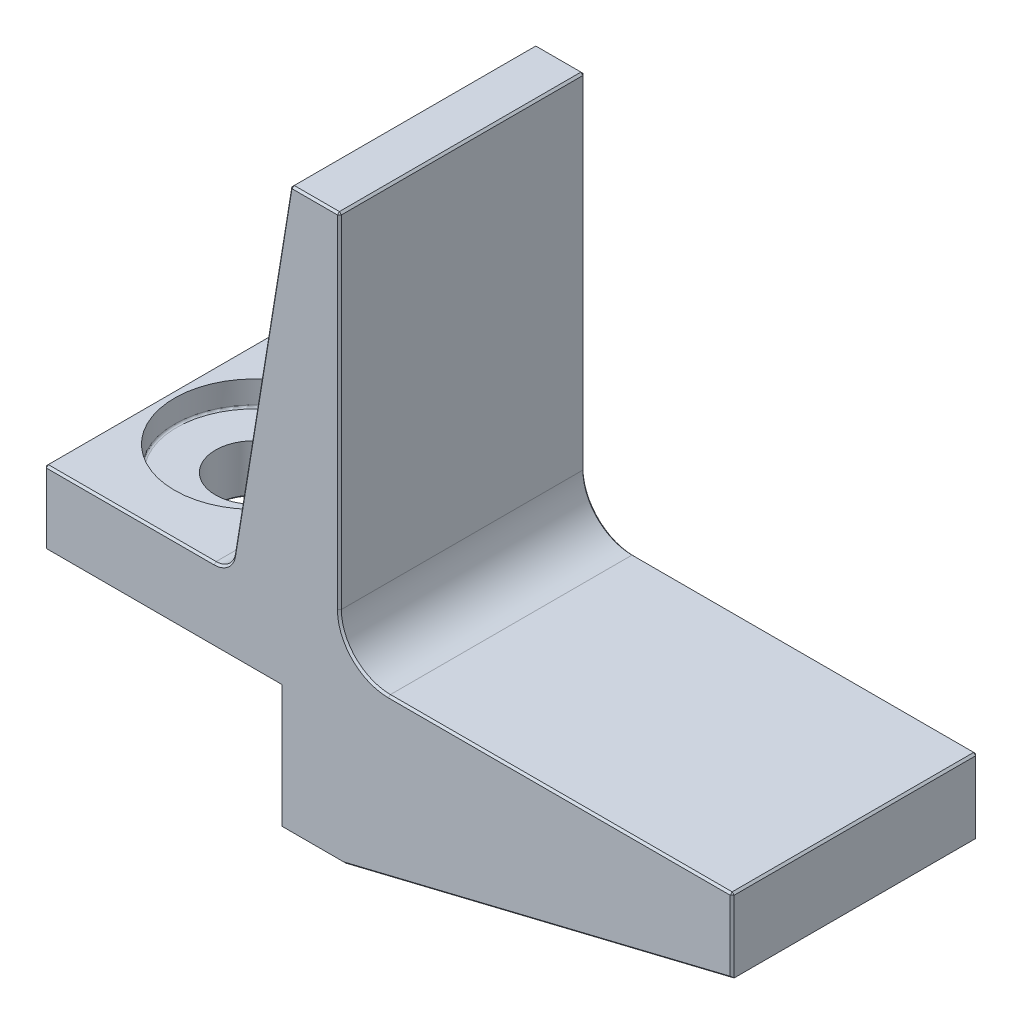
from build123d import *
from OCP.BRepFilletAPI import BRepFilletAPI_MakeChamfer

# Parameters (mm, degrees)
BOSS_EXTRUDE1_DEPTH                                  = 31.75
CBORE_FOR_3_8_BINDING_HEAD_MACHINE_SCREW_D           = 10.0838
CBORE_FOR_3_8_BINDING_HEAD_MACHINE_SCREW_CBORE_D     = 20.6756
CBORE_FOR_3_8_BINDING_HEAD_MACHINE_SCREW_CBORE_DEPTH = 3.175
FILLET1_R                                            = 2.54
FILLET2_R                                            = 6.35
CHAMFER1_SIZE                                        = 0.254
CHAMFER1_SIZE2                                       = 0.30739842
FILLET3_R                                            = 0.254
CHAMFER2_SIZE                                        = 0.254


with BuildPart() as part:
    # Sketch1 → Boss-Extrude1 (new body)
    with BuildSketch(Plane.XY):
        Polygon((0, 0), (50.8, 0), (50.8, -9.525), (0.5741924, -21.771101892), (-7.6808076, -21.771101892), (-7.6808076, -5.896101892), (-38.1608076, -5.896101892), (-38.1608076, 3.628898108), (-14.0308076, 3.628898108), (-6.35, 50.8), (0, 50.8), align=None)
    extrude(amount=BOSS_EXTRUDE1_DEPTH)

    # CBORE for 3/8 Binding Head Machine Screw1 (through all)
    with Locations(Plane(origin=(0, 3.628898108, 0), x_dir=(1, 0, 0), z_dir=(0, 1, 0))):
        with Locations((-26.8578076, -15.875)):
            CounterBoreHole(CBORE_FOR_3_8_BINDING_HEAD_MACHINE_SCREW_D / 2, CBORE_FOR_3_8_BINDING_HEAD_MACHINE_SCREW_CBORE_D / 2, CBORE_FOR_3_8_BINDING_HEAD_MACHINE_SCREW_CBORE_DEPTH)

    # Fillet1
    fillet1_edges = [part.edges().sort_by_distance(p)[0] for p in [
        (-14.0308076, 3.628898108, 15.875),
    ]]
    fillet(fillet1_edges, radius=FILLET1_R)

    # Fillet2
    fillet2_edges = [part.edges().sort_by_distance(p)[0] for p in [
        (0, 0, 15.875),
    ]]
    fillet(fillet2_edges, radius=FILLET2_R)

    # Chamfer1: one chamfer whose edges measure the first distance from different faces: ONE call of the kernel's chamfer builder (chamfer() names one face for all edges)
    chamfer1_edges_1 = [part.edges().sort_by_distance(p)[0] for p in [
        (-6.35, 50.8, 15.875),
    ]]
    chamfer1_side_1 = [part.faces().sort_by_distance(p)[0] for p in [
        (-3.175, 50.8, 15.875),
    ]]
    chamfer1_edges_2 = [part.edges().sort_by_distance(p)[0] for p in [
        (-3.175, 50.8, 0),
        (-3.175, 50.8, 31.75),
        (0, 50.8, 15.875),
        (-10.016845438, 28.280344675, 0),
        (-10.016845438, 28.280344675, 31.75),
        (-14.545263998, 4.233898076, 0),
        (-14.545263998, 4.233898076, 31.75),
        (-27.175740922, 3.628898108, 0),
        (-38.1608076, 3.628898108, 15.875),
        (-27.175740922, 3.628898108, 31.75),
        (-38.1608076, -1.133601892, 0),
        (-38.1608076, -5.896101892, 15.875),
        (-38.1608076, -1.133601892, 31.75),
        (-22.9208076, -5.896101892, 0),
        (-22.9208076, -5.896101892, 31.75),
        (50.8, -4.7625, 0),
        (50.8, -4.7625, 31.75),
        (50.8, 0, 15.875),
        (28.575, 0, 0),
        (1.859871939, 1.859871939, 0),
        (1.859871939, 1.859871939, 31.75),
        (0, 28.575, 0),
        (0, 28.575, 31.75),
        (28.575, 0, 31.75),
        (-7.6808076, -13.833601892, 0),
        (-7.6808076, -13.833601892, 31.75),
        (-3.5533076, -21.771101892, 0),
        (-3.5533076, -21.771101892, 31.75),
        (25.6870962, -15.648050946, 0),
        (25.6870962, -15.648050946, 31.75),
    ]]
    chamfer1 = BRepFilletAPI_MakeChamfer(part.part.solid().wrapped)
    for e in chamfer1_edges_1:
        chamfer1.Add(CHAMFER1_SIZE, CHAMFER1_SIZE2, e.wrapped, chamfer1_side_1[0].wrapped)  # the first distance lies on this face
    for e in chamfer1_edges_2:
        chamfer1.Add(CHAMFER1_SIZE, e.wrapped)
    add(Compound.cast(chamfer1.Shape()), mode=Mode.REPLACE)

    # Fillet3
    fillet3_edges = [part.edges().sort_by_distance(p)[0] for p in [
        (-37.1956076, 0.453898108, 15.875),
    ]]
    fillet(fillet3_edges, radius=FILLET3_R)

    # Chamfer2
    chamfer2_edges = [part.edges().sort_by_distance(p)[0] for p in [
        (-21.8159076, -5.896101892, 15.875),
    ]]
    chamfer(chamfer2_edges, length=CHAMFER2_SIZE)


solid = part.part
